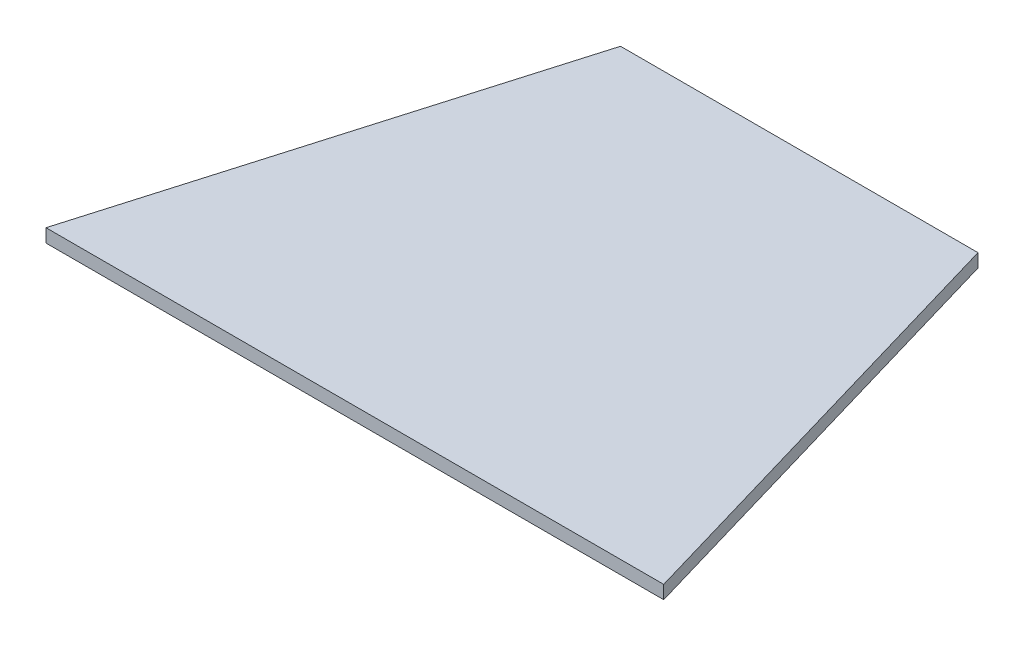
from build123d import *

# Parameters (mm, degrees)
BOSS_EXTRUDE1_DEPTH = 3


with BuildPart() as part:
    # Sketch1 → Boss-Extrude1 (new body)
    with BuildSketch(Plane(origin=(0, 0, 0), x_dir=(1, 0, 0), z_dir=(0, 1, 0))):
        Polygon((0, 0), (139, 0), (109.720058283, 100), (29.279941717, 100), align=None)
    extrude(amount=BOSS_EXTRUDE1_DEPTH)


solid = part.part
